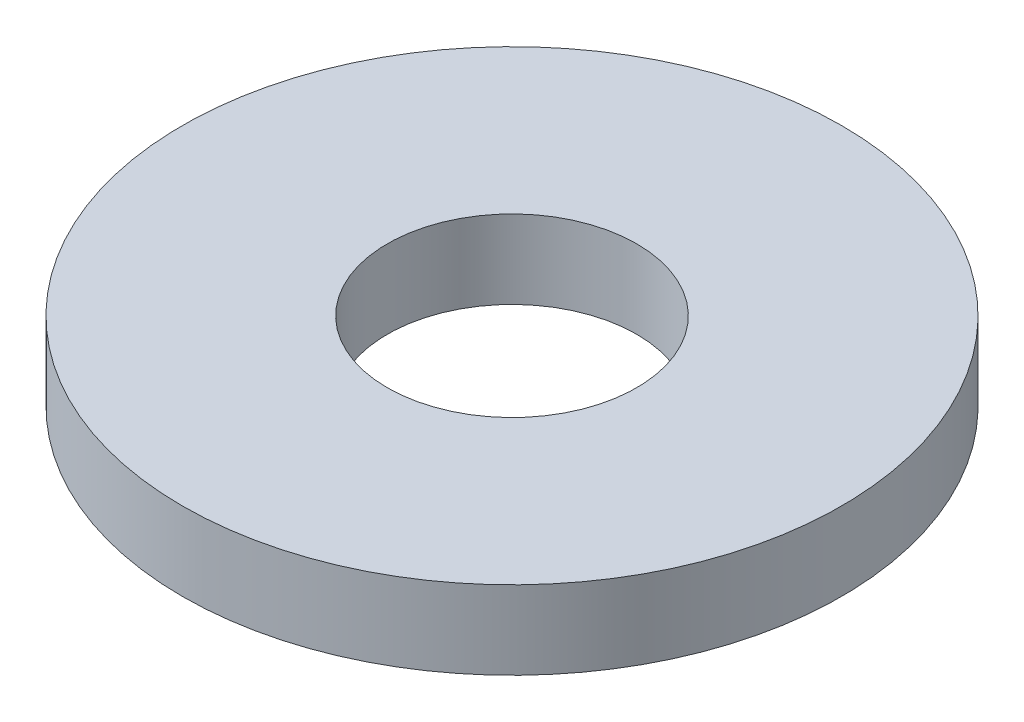
from build123d import *

# Parameters (mm, degrees)
SKETCH1_R           = 92.5
BOSS_EXTRUDE1_DEPTH = 22
SKETCH2_R           = 35
CUT_EXTRUDE1_DEPTH  = 133.651799837


with BuildPart() as part:
    # Sketch1 → Boss-Extrude1 (new body)
    with BuildSketch(Plane(origin=(0, 0, 0), x_dir=(1, 0, 0), z_dir=(0, 1, 0))):
        Circle(SKETCH1_R)
    extrude(amount=BOSS_EXTRUDE1_DEPTH)

    # Sketch2 → Cut-Extrude1 (cut, through all)
    with BuildSketch(Plane(origin=(0, 0, 0), x_dir=(1, 0, 0), z_dir=(0, 1, 0))):
        Circle(SKETCH2_R)
    extrude(amount=CUT_EXTRUDE1_DEPTH, mode=Mode.SUBTRACT)


solid = part.part
